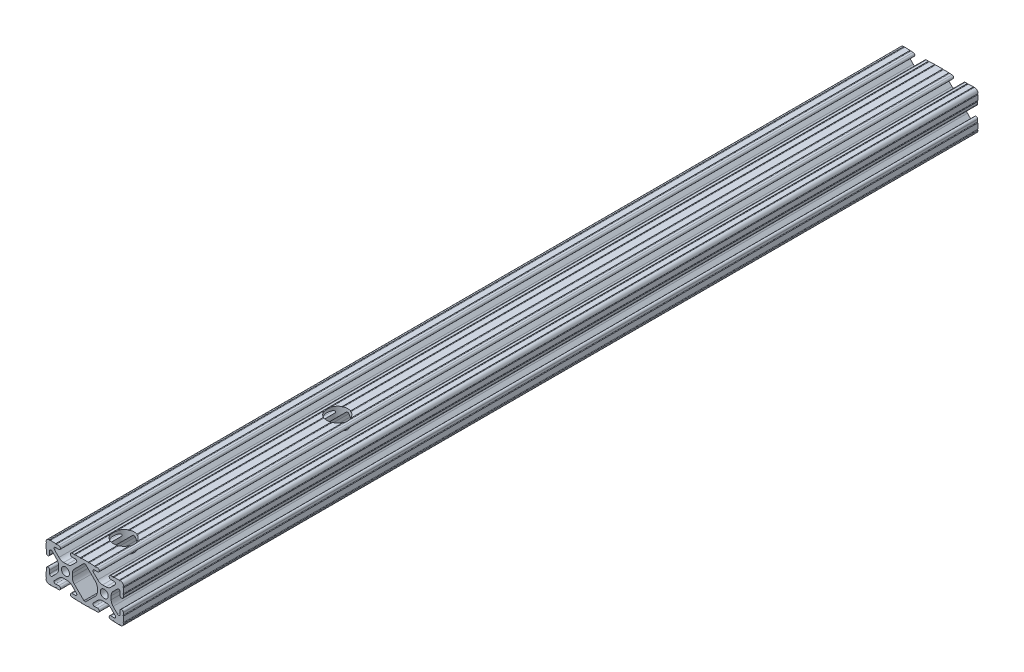
from build123d import *

# Parameters (mm, degrees)
SKETCH3_R          = 2.6035
EXTRUDE1_DEPTH     = 279.4
SKETCH4_R          = 6.75
CUT_EXTRUDE2_DEPTH = 284.127288719


with BuildPart() as part:
    # Sketch3 → Extrude1 (new, symmetric)
    with BuildSketch(Plane.XY):
        with BuildLine():
            Line((-1.115277175, 4.5085), (1.115277175, 4.5085))
            ThreePointArc((1.115277175, 4.5085), (2.806584872, 4.844922018), (4.240406305, 5.80297087))
            Line((4.240406305, 5.80297087), (7.148423664, 8.710988229))
            ThreePointArc((7.148423664, 8.710988229), (7.349906316, 9.772227925), (6.436353897, 10.348636575))
            Line((6.436353897, 10.348636575), (4.381960454, 10.276895575))
            ThreePointArc((4.381960454, 10.276895575), (3.239173075, 11.342562046), (4.304839546, 12.485349424))
            Line((4.304839546, 12.485349424), (5.728246175, 12.535055879))
            ThreePointArc((5.728246175, 12.535055879), (6.054756855, 12.230579745), (6.35923299, 12.557090424))
            Line((6.35923299, 12.557090424), (9.782092278, 12.676619304))
            ThreePointArc((9.782092278, 12.676619304), (10.108602958, 12.37214317), (10.413079092, 12.69865385))
            Line((10.413079092, 12.69865385), (14.986920908, 12.69865385))
            ThreePointArc((14.986920908, 12.69865385), (15.291397042, 12.37214317), (15.617907722, 12.676619304))
            Line((15.617907722, 12.676619304), (19.04076701, 12.557090424))
            ThreePointArc((19.04076701, 12.557090424), (19.345243145, 12.230579745), (19.671753825, 12.535055879))
            Line((19.671753825, 12.535055879), (21.095160454, 12.485349424))
            ThreePointArc((21.095160454, 12.485349424), (22.160826925, 11.342562046), (21.018039546, 10.276895575))
            Line((21.018039546, 10.276895575), (18.963646103, 10.348636575))
            ThreePointArc((18.963646103, 10.348636575), (18.050093684, 9.772227925), (18.251576336, 8.710988229))
            Line((18.251576336, 8.710988229), (21.159593695, 5.80297087))
            ThreePointArc((21.159593695, 5.80297087), (22.593415128, 4.844922018), (24.284722825, 4.5085))
            Line((24.284722825, 4.5085), (26.515277175, 4.5085))
            ThreePointArc((26.515277175, 4.5085), (28.206584872, 4.844922018), (29.640406305, 5.80297087))
            Line((29.640406305, 5.80297087), (32.548423664, 8.710988229))
            ThreePointArc((32.548423664, 8.710988229), (32.749906316, 9.772227925), (31.836353897, 10.348636575))
            Line((31.836353897, 10.348636575), (29.781960454, 10.276895575))
            ThreePointArc((29.781960454, 10.276895575), (28.639173075, 11.342562046), (29.704839546, 12.485349424))
            Line((29.704839546, 12.485349424), (31.128246175, 12.535055879))
            ThreePointArc((31.128246175, 12.535055879), (31.454756855, 12.230579745), (31.75923299, 12.557090424))
            Line((31.75923299, 12.557090424), (35.182092278, 12.676619304))
            ThreePointArc((35.182092278, 12.676619304), (35.508602958, 12.37214317), (35.813079092, 12.69865385))
            ThreePointArc((35.813079092, 12.69865385), (37.452764565, 12.052764565), (38.09865385, 10.413079092))
            ThreePointArc((38.09865385, 10.413079092), (37.77214317, 10.108602958), (38.076619304, 9.782092278))
            Line((38.076619304, 9.782092278), (37.957090424, 6.35923299))
            ThreePointArc((37.957090424, 6.35923299), (37.630579745, 6.054756855), (37.935055879, 5.728246175))
            Line((37.935055879, 5.728246175), (37.885349424, 4.304839546))
            ThreePointArc((37.885349424, 4.304839546), (36.742562046, 3.239173075), (35.676895575, 4.381960454))
            Line((35.676895575, 4.381960454), (35.748636575, 6.436353897))
            ThreePointArc((35.748636575, 6.436353897), (35.172227925, 7.349906316), (34.110988229, 7.148423664))
            Line((34.110988229, 7.148423664), (31.202970856, 4.240406291))
            ThreePointArc((31.202970856, 4.240406291), (30.244922014, 2.806584863), (29.9085, 1.115277175))
            Line((29.9085, 1.115277175), (29.9085, -1.115277175))
            ThreePointArc((29.9085, -1.115277175), (30.244922014, -2.806584863), (31.202970856, -4.240406291))
            Line((31.202970856, -4.240406291), (34.110988229, -7.148423664))
            ThreePointArc((34.110988229, -7.148423664), (35.172227925, -7.349906316), (35.748636575, -6.436353897))
            Line((35.748636575, -6.436353897), (35.676895575, -4.381960454))
            ThreePointArc((35.676895575, -4.381960454), (36.742562046, -3.239173075), (37.885349424, -4.304839546))
            Line((37.885349424, -4.304839546), (37.935055879, -5.728246175))
            ThreePointArc((37.935055879, -5.728246175), (37.630579745, -6.054756855), (37.957090424, -6.35923299))
            Line((37.957090424, -6.35923299), (38.076619304, -9.782092278))
            ThreePointArc((38.076619304, -9.782092278), (37.77214317, -10.108602958), (38.09865385, -10.413079092))
            ThreePointArc((38.09865385, -10.413079092), (37.452764565, -12.052764565), (35.813079092, -12.69865385))
            ThreePointArc((35.813079092, -12.69865385), (35.508602958, -12.37214317), (35.182092278, -12.676619304))
            Line((35.182092278, -12.676619304), (31.75923299, -12.557090424))
            ThreePointArc((31.75923299, -12.557090424), (31.454756855, -12.230579745), (31.128246175, -12.535055879))
            Line((31.128246175, -12.535055879), (29.704839546, -12.485349424))
            ThreePointArc((29.704839546, -12.485349424), (28.639173075, -11.342562046), (29.781960454, -10.276895575))
            Line((29.781960454, -10.276895575), (31.836353897, -10.348636575))
            ThreePointArc((31.836353897, -10.348636575), (32.749906316, -9.772227925), (32.548423664, -8.710988229))
            Line((32.548423664, -8.710988229), (29.640406305, -5.80297087))
            ThreePointArc((29.640406305, -5.80297087), (28.206584872, -4.844922018), (26.515277175, -4.5085))
            Line((26.515277175, -4.5085), (24.284722825, -4.5085))
            ThreePointArc((24.284722825, -4.5085), (22.593415128, -4.844922018), (21.159593695, -5.80297087))
            Line((21.159593695, -5.80297087), (18.251576336, -8.710988229))
            ThreePointArc((18.251576336, -8.710988229), (18.050093684, -9.772227925), (18.963646103, -10.348636575))
            Line((18.963646103, -10.348636575), (21.018039546, -10.276895575))
            ThreePointArc((21.018039546, -10.276895575), (22.160826925, -11.342562046), (21.095160454, -12.485349424))
            Line((21.095160454, -12.485349424), (19.671753825, -12.535055879))
            ThreePointArc((19.671753825, -12.535055879), (19.345243145, -12.230579745), (19.04076701, -12.557090424))
            Line((19.04076701, -12.557090424), (15.617907722, -12.676619304))
            ThreePointArc((15.617907722, -12.676619304), (15.291397042, -12.37214317), (14.986920908, -12.69865385))
            Line((14.986920908, -12.69865385), (10.413079092, -12.69865385))
            ThreePointArc((10.413079092, -12.69865385), (10.108602958, -12.37214317), (9.782092278, -12.676619304))
            Line((9.782092278, -12.676619304), (6.35923299, -12.557090424))
            ThreePointArc((6.35923299, -12.557090424), (6.054756855, -12.230579745), (5.728246175, -12.535055879))
            Line((5.728246175, -12.535055879), (4.304839546, -12.485349424))
            ThreePointArc((4.304839546, -12.485349424), (3.239173075, -11.342562046), (4.381960454, -10.276895575))
            Line((4.381960454, -10.276895575), (6.436353897, -10.348636575))
            ThreePointArc((6.436353897, -10.348636575), (7.349906316, -9.772227925), (7.148423664, -8.710988229))
            Line((7.148423664, -8.710988229), (4.240406305, -5.80297087))
            ThreePointArc((4.240406305, -5.80297087), (2.806584872, -4.844922018), (1.115277175, -4.5085))
            Line((1.115277175, -4.5085), (-1.115277175, -4.5085))
            ThreePointArc((-1.115277175, -4.5085), (-2.806584872, -4.844922018), (-4.240406305, -5.80297087))
            Line((-4.240406305, -5.80297087), (-7.148423664, -8.710988229))
            ThreePointArc((-7.148423664, -8.710988229), (-7.349906316, -9.772227925), (-6.436353897, -10.348636575))
            Line((-6.436353897, -10.348636575), (-4.381960454, -10.276895575))
            ThreePointArc((-4.381960454, -10.276895575), (-3.239173075, -11.342562046), (-4.304839546, -12.485349424))
            Line((-4.304839546, -12.485349424), (-5.728246175, -12.535055879))
            ThreePointArc((-5.728246175, -12.535055879), (-6.054756855, -12.230579745), (-6.35923299, -12.557090424))
            Line((-6.35923299, -12.557090424), (-9.782092278, -12.676619304))
            ThreePointArc((-9.782092278, -12.676619304), (-10.108602958, -12.37214317), (-10.413079092, -12.69865385))
            ThreePointArc((-10.413079092, -12.69865385), (-12.052764565, -12.052764565), (-12.69865385, -10.413079092))
            ThreePointArc((-12.69865385, -10.413079092), (-12.37214317, -10.108602958), (-12.676619304, -9.782092278))
            Line((-12.676619304, -9.782092278), (-12.557090424, -6.35923299))
            ThreePointArc((-12.557090424, -6.35923299), (-12.230579745, -6.054756855), (-12.535055879, -5.728246175))
            Line((-12.535055879, -5.728246175), (-12.485349424, -4.304839546))
            ThreePointArc((-12.485349424, -4.304839546), (-11.342562046, -3.239173075), (-10.276895575, -4.381960454))
            Line((-10.276895575, -4.381960454), (-10.348636575, -6.436353897))
            ThreePointArc((-10.348636575, -6.436353897), (-9.772227925, -7.349906316), (-8.710988229, -7.148423664))
            Line((-8.710988229, -7.148423664), (-5.802970856, -4.240406291))
            ThreePointArc((-5.802970856, -4.240406291), (-4.844922014, -2.806584863), (-4.5085, -1.115277175))
            Line((-4.5085, -1.115277175), (-4.5085, 1.115277175))
            ThreePointArc((-4.5085, 1.115277175), (-4.844922014, 2.806584863), (-5.802970856, 4.240406291))
            Line((-5.802970856, 4.240406291), (-8.710988229, 7.148423664))
            ThreePointArc((-8.710988229, 7.148423664), (-9.772227925, 7.349906316), (-10.348636575, 6.436353897))
            Line((-10.348636575, 6.436353897), (-10.276895575, 4.381960454))
            ThreePointArc((-10.276895575, 4.381960454), (-11.342562046, 3.239173075), (-12.485349424, 4.304839546))
            Line((-12.485349424, 4.304839546), (-12.535055879, 5.728246175))
            ThreePointArc((-12.535055879, 5.728246175), (-12.230579745, 6.054756855), (-12.557090424, 6.35923299))
            Line((-12.557090424, 6.35923299), (-12.676619304, 9.782092278))
            ThreePointArc((-12.676619304, 9.782092278), (-12.37214317, 10.108602958), (-12.69865385, 10.413079092))
            ThreePointArc((-12.69865385, 10.413079092), (-12.052764565, 12.052764565), (-10.413079092, 12.69865385))
            ThreePointArc((-10.413079092, 12.69865385), (-10.108602958, 12.37214317), (-9.782092278, 12.676619304))
            Line((-9.782092278, 12.676619304), (-6.35923299, 12.557090424))
            ThreePointArc((-6.35923299, 12.557090424), (-6.054756855, 12.230579745), (-5.728246175, 12.535055879))
            Line((-5.728246175, 12.535055879), (-4.304839546, 12.485349424))
            ThreePointArc((-4.304839546, 12.485349424), (-3.239173075, 11.342562046), (-4.381960454, 10.276895575))
            Line((-4.381960454, 10.276895575), (-6.436353897, 10.348636575))
            ThreePointArc((-6.436353897, 10.348636575), (-7.349906316, 9.772227925), (-7.148423664, 8.710988229))
            Line((-7.148423664, 8.710988229), (-4.240406305, 5.80297087))
            ThreePointArc((-4.240406305, 5.80297087), (-2.806584872, 4.844922018), (-1.115277175, 4.5085))
        make_face()
        with Locations((25.4, 0)):
            Circle(SKETCH3_R, mode=Mode.SUBTRACT)
        Circle(SKETCH3_R, mode=Mode.SUBTRACT)
        with BuildLine():
            Line((5.802970856, 4.240406291), (12.109304956, 10.546740391))
            Line((12.109304956, 10.546740391), (12.7, 10.567367916))
            Line((12.7, 10.567367916), (13.290695044, 10.546740391))
            Line((13.290695044, 10.546740391), (19.597029144, 4.240406291))
            ThreePointArc((19.597029144, 4.240406291), (20.555077986, 2.806584863), (20.8915, 1.115277175))
            Line((20.8915, 1.115277175), (20.8915, -1.115277175))
            ThreePointArc((20.8915, -1.115277175), (20.555077986, -2.806584863), (19.597029144, -4.240406291))
            Line((19.597029144, -4.240406291), (13.290695044, -10.546740391))
            Line((13.290695044, -10.546740391), (12.7, -10.567367916))
            Line((12.7, -10.567367916), (12.109304956, -10.546740391))
            Line((12.109304956, -10.546740391), (5.802970856, -4.240406291))
            ThreePointArc((5.802970856, -4.240406291), (4.844922014, -2.806584863), (4.5085, -1.115277175))
            Line((4.5085, -1.115277175), (4.5085, 1.115277175))
            ThreePointArc((4.5085, 1.115277175), (4.844922014, 2.806584863), (5.802970856, 4.240406291))
        make_face(mode=Mode.SUBTRACT)
    extrude(amount=EXTRUDE1_DEPTH, both=True)

    # Sketch4 → Cut-Extrude2 (cut, through all)
    with BuildSketch(Plane(origin=(0, 12.69865385, 0), x_dir=(1, 0, 0), z_dir=(0, 1, 0))):
        with Locations((12.7, -254)):
            Circle(SKETCH4_R)
        with Locations((12.7, -114.3)):
            Circle(SKETCH4_R)
    extrude(amount=-CUT_EXTRUDE2_DEPTH, mode=Mode.SUBTRACT)


solid = part.part
